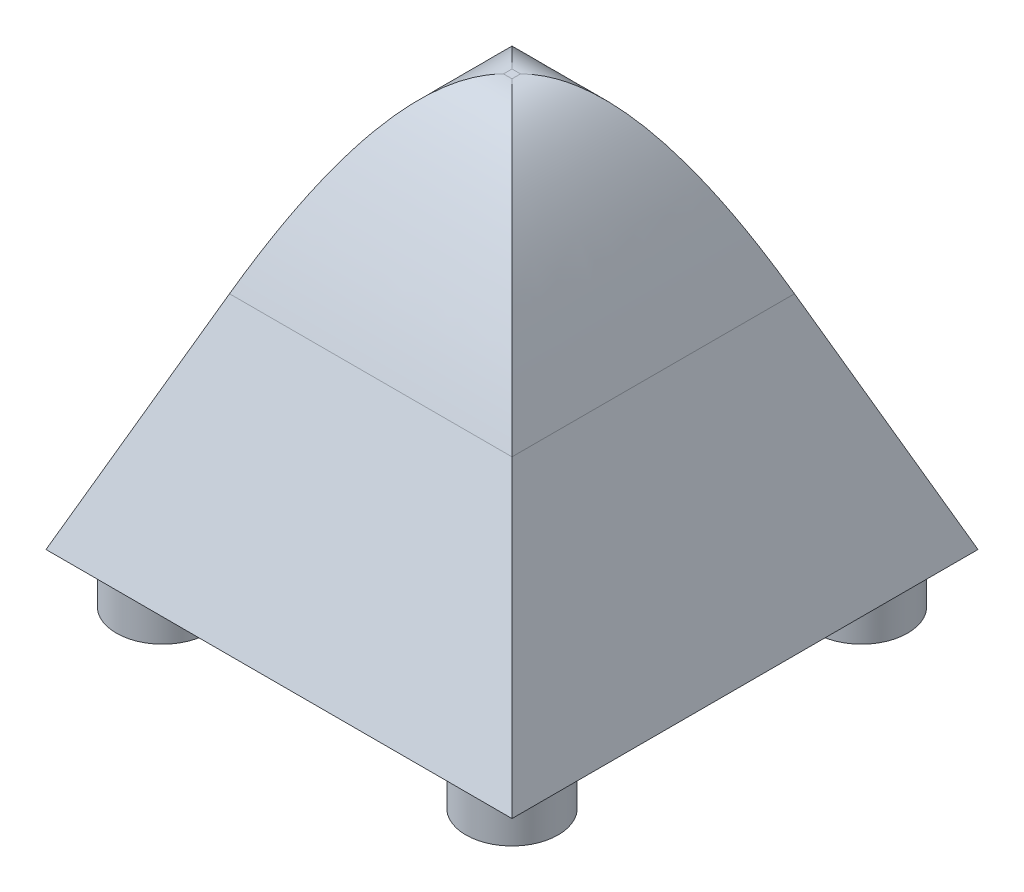
from build123d import *

# Parameters (mm, degrees)
ESQUISSE6_W        = 28.284271248
ESQUISSE6_H        = 28.284271248
BOSS_EXTRU_2_DEPTH = 25
BOSS_EXTRU_2_TAPER = 22.5
ESQUISSE7_R        = 2.8
BOSS_EXTRU_3_DEPTH = 3


with BuildPart() as part:
    # Esquisse6 → Boss.-Extru.2 (new body)
    with BuildSketch(Plane(origin=(0, 0, 0), x_dir=(1, 0, 0), z_dir=(0, 1, 0))):
        Rectangle(ESQUISSE6_W, ESQUISSE6_H)
    extrude(amount=BOSS_EXTRU_2_DEPTH, taper=BOSS_EXTRU_2_TAPER)

    # Congé3
    # a fillet whose section is not a circle: 15, 9 mm, written as the material it takes off along each edge
    with BuildSketch(Plane(origin=(-35.056698922, 25, 3.786796564), x_dir=(0, -0.9238795325112864, 0.38268343236509067), z_dir=(1, 0, 0)), Plane(origin=(-3.786796564, 25, -35.056698922), x_dir=(-0.3826834323650906, -0.9238795325112864, 0), z_dir=(0, 0, 1)), Plane(origin=(35.056698922, 25, -3.786796564), x_dir=(0, -0.9238795325112864, -0.38268343236509056), z_dir=(-1, 0, 0)), Plane(origin=(3.786796564, 25, 35.056698922), x_dir=(0.3826834323650906, -0.9238795325112864, 0), z_dir=(0, 0, -1))) as cong_3_piece_1:
        with BuildLine():
            Bezier((12.507960943, 0), (0, 0), (-1.350232045, 3.259748515), weights=[1, 1, 1])
            Line((-1.350232045, 3.259748515), (0, 0))
            Line((0, 0), (12.507960943, 0))
        make_face()
    extrude(amount=70.113397844, mode=Mode.SUBTRACT)

    # Esquisse7 → Boss.-Extru.3 (add)
    with BuildSketch(Plane.XZ):
        with Locations(Location((-10.606601718, 10.606601718, 0), (0, 0, 90))):
            Circle(ESQUISSE7_R)
        with Locations(Location((10.606601718, 10.606601718, 0), (0, 0, 90))):
            Circle(ESQUISSE7_R)
        with Locations(Location((10.606601718, -10.606601718, 0), (0, 0, 90))):
            Circle(ESQUISSE7_R)
        with Locations(Location((-10.606601718, -10.606601718, 0), (0, 0, 90))):
            Circle(ESQUISSE7_R)
    extrude(amount=BOSS_EXTRU_3_DEPTH)


solid = part.part
